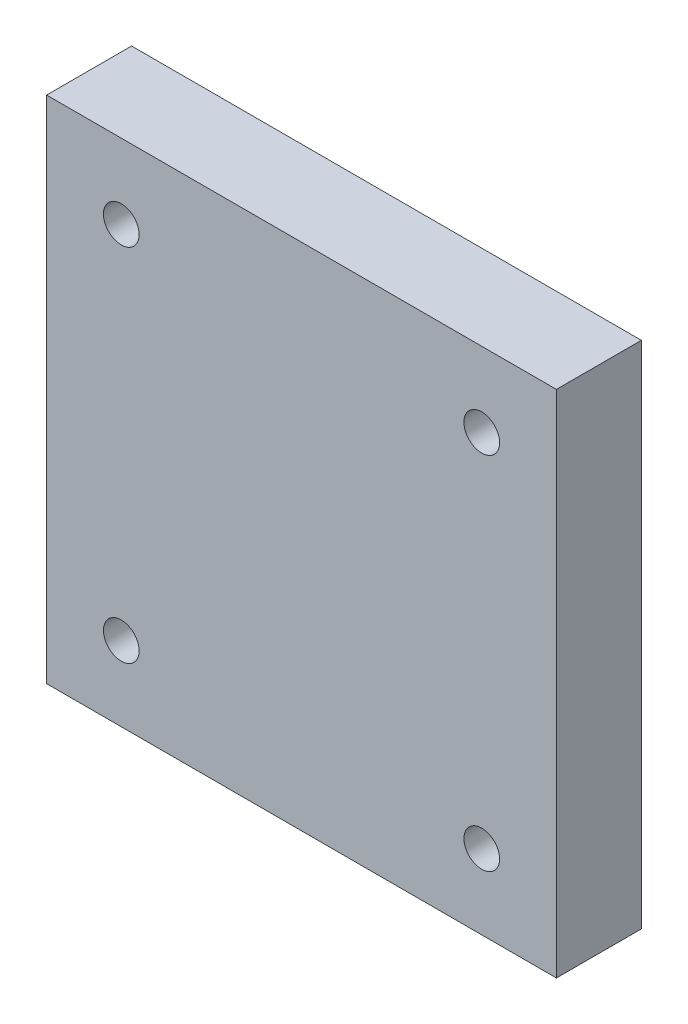
from build123d import *

# Parameters (mm, degrees)
SKETCH1_W           = 30
SKETCH1_H           = 30
BOSS_EXTRUDE1_DEPTH = 5
CAVITY1_OUTLINE_R   = 1.05
CAVITY1_DEPTH       = 5


# Read off the part's stored shape, not the designer's step: Cavity1
with BuildPart() as part:
    # Sketch1 → Boss-Extrude1 (new body)
    with BuildSketch(Plane.XY):
        with Locations((15, 15)):
            Rectangle(SKETCH1_W, SKETCH1_H)
    extrude(amount=BOSS_EXTRUDE1_DEPTH)

    # Cavity1 outline → Cavity1 (cut)
    with BuildSketch(Plane.XY):
        with Locations((25.606601718, 25.606601718)):
            Circle(CAVITY1_OUTLINE_R)
        with Locations((25.606601718, 4.393398282)):
            Circle(CAVITY1_OUTLINE_R)
        with Locations((4.393398282, 25.606601718)):
            Circle(CAVITY1_OUTLINE_R)
        with Locations((4.393398282, 4.393398282)):
            Circle(CAVITY1_OUTLINE_R)
    extrude(amount=CAVITY1_DEPTH, mode=Mode.SUBTRACT)


solid = part.part
